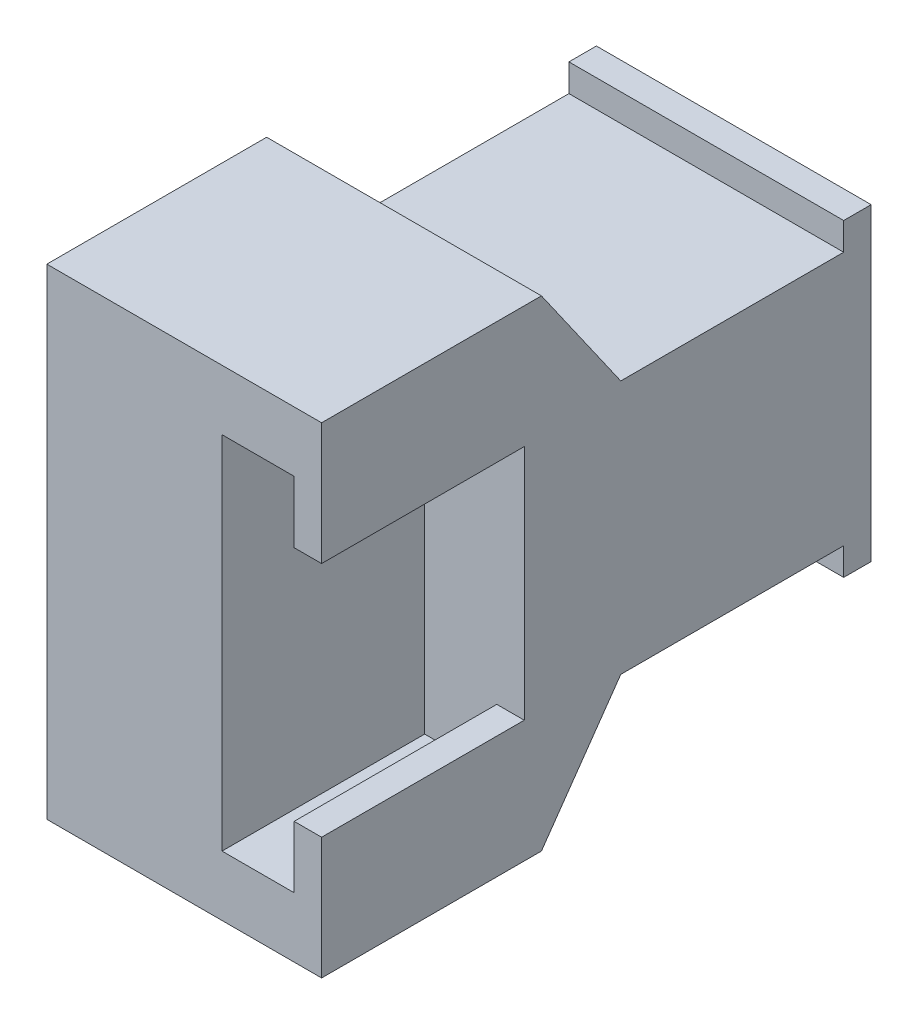
from build123d import *

# Parameters (mm, degrees)
IZIM1_W                     = 20
IZIM1_H                     = 18.5
Y_KSEKLIK_EKSTR_ZYON1_DEPTH = 17
IZIM2_W                     = 20
IZIM2_H                     = 2
Y_KSEKLIK_EKSTR_ZYON2_DEPTH = 2
IZIM3_W                     = 20
IZIM3_H                     = 2
Y_KSEKLIK_EKSTR_ZYON3_DEPTH = 2
IZIM4_W                     = 20
IZIM4_H                     = 35
Y_KSEKLIK_EKSTR_ZYON4_DEPTH = 23
PAH1_SIZE                   = 7
PAH1_SIZE_2                 = 10
PAH2_SIZE                   = 7
PAH2_SIZE_2                 = 10
IZIM5_W                     = 5.25
IZIM5_H                     = 26.25
KES_EKSTR_ZYON2_DEPTH       = 14.75
IZIM6_W                     = 2
IZIM6_H                     = 17.25
KES_EKSTR_ZYON3_DEPTH       = 14.75


with BuildPart() as part:
    # Çizim1 → Yükseklik-Ekstrüzyon1 (new body)
    with BuildSketch(Plane.XY):
        Rectangle(IZIM1_W, IZIM1_H)
    extrude(amount=Y_KSEKLIK_EKSTR_ZYON1_DEPTH)

    # Çizim2 → Yükseklik-Ekstrüzyon2 (add)
    with BuildSketch(Plane.XZ.offset(9.25)):
        with Locations((0, 1)):
            Rectangle(IZIM2_W, IZIM2_H)
    extrude(amount=Y_KSEKLIK_EKSTR_ZYON2_DEPTH)

    # Çizim3 → Yükseklik-Ekstrüzyon3 (add)
    with BuildSketch(Plane(origin=(0, 9.25, 0), x_dir=(1, 0, 0), z_dir=(0, 1, 0))):
        with Locations((0, -1)):
            Rectangle(IZIM3_W, IZIM3_H)
    extrude(amount=Y_KSEKLIK_EKSTR_ZYON3_DEPTH)

    # Çizim4 → Yükseklik-Ekstrüzyon4 (add)
    with BuildSketch(Plane.XY.offset(17)):
        Rectangle(IZIM4_W, IZIM4_H)
    extrude(amount=Y_KSEKLIK_EKSTR_ZYON4_DEPTH)

    # Pah1
    # the kernel refuses this chamfer: 10, 7 mm, written as the material it takes off along each edge
    with BuildSketch(Plane(origin=(-35.825599626, 17.5, 17), x_dir=(0, 0.045281396304095924, 0.9989742715149131), z_dir=(1, 0, 0))) as pah1_piece_1_section:
        Polygon((PAH1_SIZE * 0.998974271515, PAH1_SIZE * 0.0452813963041), (-PAH1_SIZE_2 * 0.0452813963041, PAH1_SIZE_2 * 0.998974271515), (0, 0), align=None)
    pah1_piece_1 = extrude(amount=71.651199251, mode=Mode.PRIVATE)
    pah1_piece_1 = split(pah1_piece_1, bisect_by=Plane(origin=(0, 9.25, 19.372622849), z_dir=(0, 1, 0)), keep=Keep.TOP, mode=Mode.PRIVATE)
    add(pah1_piece_1, mode=Mode.SUBTRACT)

    # Pah2
    # the kernel refuses this chamfer: 10, 7 mm, written as the material it takes off along each edge
    with BuildSketch(Plane(origin=(35.825599626, -17.5, 17), x_dir=(0, -0.045281396304095924, 0.9989742715149131), z_dir=(-1, 0, 0))) as pah2_piece_1_section:
        Polygon((PAH2_SIZE * 0.998974271515, PAH2_SIZE * 0.0452813963041), (-PAH2_SIZE_2 * 0.0452813963041, PAH2_SIZE_2 * 0.998974271515), (0, 0), align=None)
    pah2_piece_1 = extrude(amount=71.651199251, mode=Mode.PRIVATE)
    pah2_piece_1 = split(pah2_piece_1, bisect_by=Plane(origin=(0, -9.25, 19.372622849), z_dir=(0, -1, 0)), keep=Keep.TOP, mode=Mode.PRIVATE)
    add(pah2_piece_1, mode=Mode.SUBTRACT)

    # Çizim5 → Kes-Ekstrüzyon2 (cut)
    with BuildSketch(Plane.XY.offset(40)):
        with Locations((5.375, 0)):
            Rectangle(IZIM5_W, IZIM5_H)
    extrude(amount=-KES_EKSTR_ZYON2_DEPTH, mode=Mode.SUBTRACT)

    # Çizim6 → Kes-Ekstrüzyon3 (cut)
    with BuildSketch(Plane.XY.offset(40)):
        with Locations((9, 0)):
            Rectangle(IZIM6_W, IZIM6_H)
    extrude(amount=-KES_EKSTR_ZYON3_DEPTH, mode=Mode.SUBTRACT)


solid = part.part
